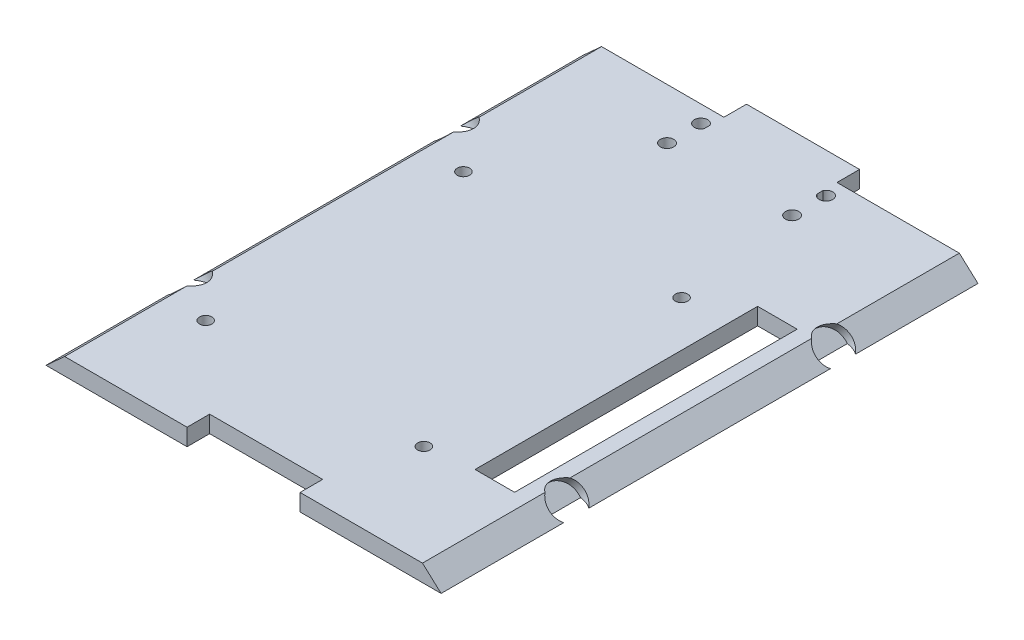
from build123d import *

# Parameters (mm, degrees)
BOSS_EXTRUDE1_DEPTH = 120.65
SKETCH2_R           = 1.397
SKETCH2_R_2         = 1.5
CUT_EXTRUDE1_DEPTH  = 129.616537105
SKETCH3_W           = 25.4
SKETCH3_H           = 5.08
CUT_EXTRUDE2_DEPTH  = 129.616537105
SKETCH5_W           = 25.4
SKETCH5_H           = 10.16
BOSS_EXTRUDE3_DEPTH = 3.81
SKETCH6_W           = 8.89
SKETCH6_H           = 63.5
CUT_EXTRUDE3_DEPTH  = 129.616537105
SKETCH7_R           = 4
CUT_EXTRUDE4_DEPTH  = 2
SKETCH8_R           = 4
CUT_EXTRUDE5_DEPTH  = 2


with BuildPart() as part:
    # Sketch1 → Boss-Extrude1 (new body)
    with BuildSketch(Plane.XY):
        Polygon((-40.203883769, 5.937788296), (40.203883769, 5.937788296), (44.399042974, 2.127788296), (-44.399042974, 2.127788296), align=None)
    extrude(amount=BOSS_EXTRUDE1_DEPTH)

    # Sketch2 → Cut-Extrude1 (cut, through all)
    with BuildSketch(Plane.XZ.offset(-2.127788296)):
        with Locations((-31.369, 97.79)):
            Circle(SKETCH2_R)
        with Locations((17.653, 39.878)):
            Circle(SKETCH2_R)
        with Locations((-31.369, 39.878)):
            Circle(SKETCH2_R)
        with Locations((17.653, 97.79)):
            Circle(SKETCH2_R)
        with Locations((-14.05, 11.43)):
            Circle(SKETCH2_R_2)
        with Locations((14.05, 3.81)):
            Circle(SKETCH2_R_2)
        with Locations((-14.05, 3.81)):
            Circle(SKETCH2_R_2)
        with Locations((14.05, 11.43)):
            Circle(SKETCH2_R_2)
    extrude(amount=-CUT_EXTRUDE1_DEPTH, mode=Mode.SUBTRACT)

    # Sketch3 → Cut-Extrude2 (cut, through all)
    with BuildSketch(Plane.XZ.offset(-2.127788296)):
        with Locations((0, 118.11)):
            Rectangle(SKETCH3_W, SKETCH3_H)
        with Locations((0, 2.54)):
            Rectangle(SKETCH3_W, SKETCH3_H)
    extrude(amount=-CUT_EXTRUDE2_DEPTH, mode=Mode.SUBTRACT)

    # Sketch5 → Boss-Extrude3 (add)
    with BuildSketch(Plane.XZ.offset(-2.127788296)):
        Rectangle(SKETCH5_W, SKETCH5_H)
    extrude(amount=-BOSS_EXTRUDE3_DEPTH)

    # Sketch6 → Cut-Extrude3 (cut, through all)
    with BuildSketch(Plane.XZ.offset(-2.127788296)):
        with Locations((32.334042974, 64.77)):
            Rectangle(SKETCH6_W, SKETCH6_H)
    extrude(amount=-CUT_EXTRUDE3_DEPTH, mode=Mode.SUBTRACT)

    # Sketch7 → Cut-Extrude4 (cut)
    with BuildSketch(Plane(origin=(21.127225221, 23.263011377, 0), x_dir=(0.7402720771062566, -0.6723074087475077, 0), z_dir=(0.6723074087475077, 0.7402720771062566, 0))):
        with Locations((28.603318705, -90.297)):
            Circle(SKETCH7_R)
        with Locations((28.603318705, -30.353)):
            Circle(SKETCH7_R)
    extrude(amount=-CUT_EXTRUDE4_DEPTH, mode=Mode.SUBTRACT)

    # Sketch8 → Cut-Extrude5 (cut)
    with BuildSketch(Plane(origin=(-21.127225221, 23.263011377, 0), x_dir=(0.7402720771062566, 0.6723074087475077, 0), z_dir=(-0.6723074087475077, 0.7402720771062566, 0))):
        with Locations((-28.603318705, -30.353)):
            Circle(SKETCH8_R)
        with Locations((-28.603318705, -90.297)):
            Circle(SKETCH8_R)
    extrude(amount=-CUT_EXTRUDE5_DEPTH, mode=Mode.SUBTRACT)


solid = part.part
